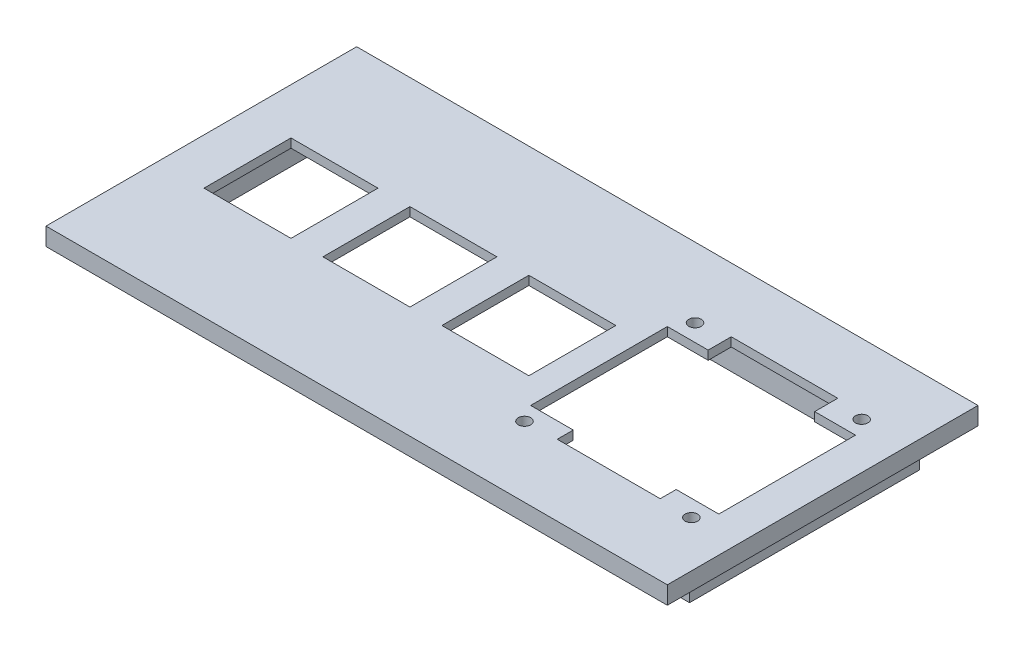
from build123d import *

# Parameters (mm, degrees)
SKETCH2_W               = 88.9
SKETCH2_H               = 44.45
BOSS_EXTRUDE1_DEPTH     = 2.54
SKETCH5_W               = 83.82
SKETCH5_H               = 32.893
BOSS_EXTRUDE2_DEPTH     = 3.81
SHELL1_START            = -3.81
SHELL1_OUTLINE_W        = 81.28
SHELL1_OUTLINE_H        = 30.353
SHELL1_DEPTH            = 5.08
CUT_EXTRUDE1_DEPTH      = 51.100654936
CUT_EXTRUDE1_DEPTH_BACK = 51.100654936
SKETCH3_W               = 26.924
SKETCH3_H               = 19.558
CUT_EXTRUDE2_DEPTH      = 51.100654936
CUT_EXTRUDE2_DEPTH_BACK = 51.100654936
SKETCH4_W               = 12.446
SKETCH4_H               = 12.446
CUT_EXTRUDE3_DEPTH      = 51.100654936
CUT_EXTRUDE3_DEPTH_BACK = 2.54
SKETCH3_3_R             = 0.889
SKETCH6_W               = 14.732
SKETCH6_H               = 2.286
SKETCH6_W_2             = 15.24
SKETCH6_H_2             = 3.302
CUT_EXTRUDE4_DEPTH      = 2.54


# Read off the part's stored shape, not the designer's step: Shell1
with BuildPart() as part:
    # Sketch2 → Boss-Extrude1 (new body)
    with BuildSketch(Plane(origin=(0, 0, 0), x_dir=(1, 0, 0), z_dir=(0, 1, 0))):
        Rectangle(SKETCH2_W, SKETCH2_H)
    extrude(amount=BOSS_EXTRUDE1_DEPTH)

    # Sketch5 → Boss-Extrude2 (add)
    with BuildSketch(Plane.XZ):
        with Locations((0, 0.0635)):
            Rectangle(SKETCH5_W, SKETCH5_H)
    extrude(amount=BOSS_EXTRUDE2_DEPTH)

    # Shell1 outline → Shell1 (cut)
    with BuildSketch(Plane(origin=(0, 0, 0), x_dir=(1, 0, 0), z_dir=(0, 1, 0)).offset(SHELL1_START)):
        with Locations((0, -0.0635)):
            Rectangle(SHELL1_OUTLINE_W, SHELL1_OUTLINE_H)
    extrude(amount=SHELL1_DEPTH, mode=Mode.SUBTRACT)

    # Sketch3 → Cut-Extrude1 (cut, two sides: drawn at the far end of the back side and taken through both)
    with BuildSketch(Plane(origin=(0, 2.54, 0), x_dir=(1, 0, 0), z_dir=(0, 1, 0)).offset(-CUT_EXTRUDE1_DEPTH_BACK)):
        with Locations((25.908, 0)):
            Rectangle(SKETCH3_W, SKETCH3_H)
    extrude(amount=CUT_EXTRUDE1_DEPTH + CUT_EXTRUDE1_DEPTH_BACK, mode=Mode.SUBTRACT)

    # Sketch4 → Cut-Extrude2 (cut, two sides: drawn at the far end of the back side and taken through both)
    with BuildSketch(Plane(origin=(0, 2.54, 0), x_dir=(1, 0, 0), z_dir=(0, 1, 0)).offset(-CUT_EXTRUDE2_DEPTH_BACK)):
        with Locations((2.413, 0)):
            Rectangle(SKETCH4_W, SKETCH4_H)
        with Locations((-14.605, 0)):
            Rectangle(SKETCH4_W, SKETCH4_H)
        with Locations((-31.623, 0)):
            Rectangle(SKETCH4_W, SKETCH4_H)
    extrude(amount=CUT_EXTRUDE2_DEPTH + CUT_EXTRUDE2_DEPTH_BACK, mode=Mode.SUBTRACT)

    # Sketch3<3> → Cut-Extrude3 (cut, two sides: drawn at the far end of the back side and taken through both)
    with BuildSketch(Plane(origin=(0, 2.54, 0), x_dir=(1, 0, 0), z_dir=(0, 1, 0)).offset(-CUT_EXTRUDE3_DEPTH_BACK)):
        with Locations(Location((37.846, -12.183102804, 0), (0, 0, 90))):
            Circle(SKETCH3_3_R)
        with Locations(Location((13.97, -12.183102804, 0), (0, 0, 90))):
            Circle(SKETCH3_3_R)
        with Locations(Location((13.97, 12.217, 0), (0, 0, 90))):
            Circle(SKETCH3_3_R)
        with Locations(Location((37.846, 12.183102804, 0), (0, 0, 90))):
            Circle(SKETCH3_3_R)
    extrude(amount=CUT_EXTRUDE3_DEPTH + CUT_EXTRUDE3_DEPTH_BACK, mode=Mode.SUBTRACT)

    # Sketch6 → Cut-Extrude4 (cut)
    with BuildSketch(Plane(origin=(0, 2.54, 0), x_dir=(1, 0, 0), z_dir=(0, 1, 0))):
        with Locations((25.908, -10.922)):
            Rectangle(SKETCH6_W, SKETCH6_H)
        with Locations((25.908, 11.43)):
            Rectangle(SKETCH6_W_2, SKETCH6_H_2)
    extrude(amount=-CUT_EXTRUDE4_DEPTH, mode=Mode.SUBTRACT)


solid = part.part
